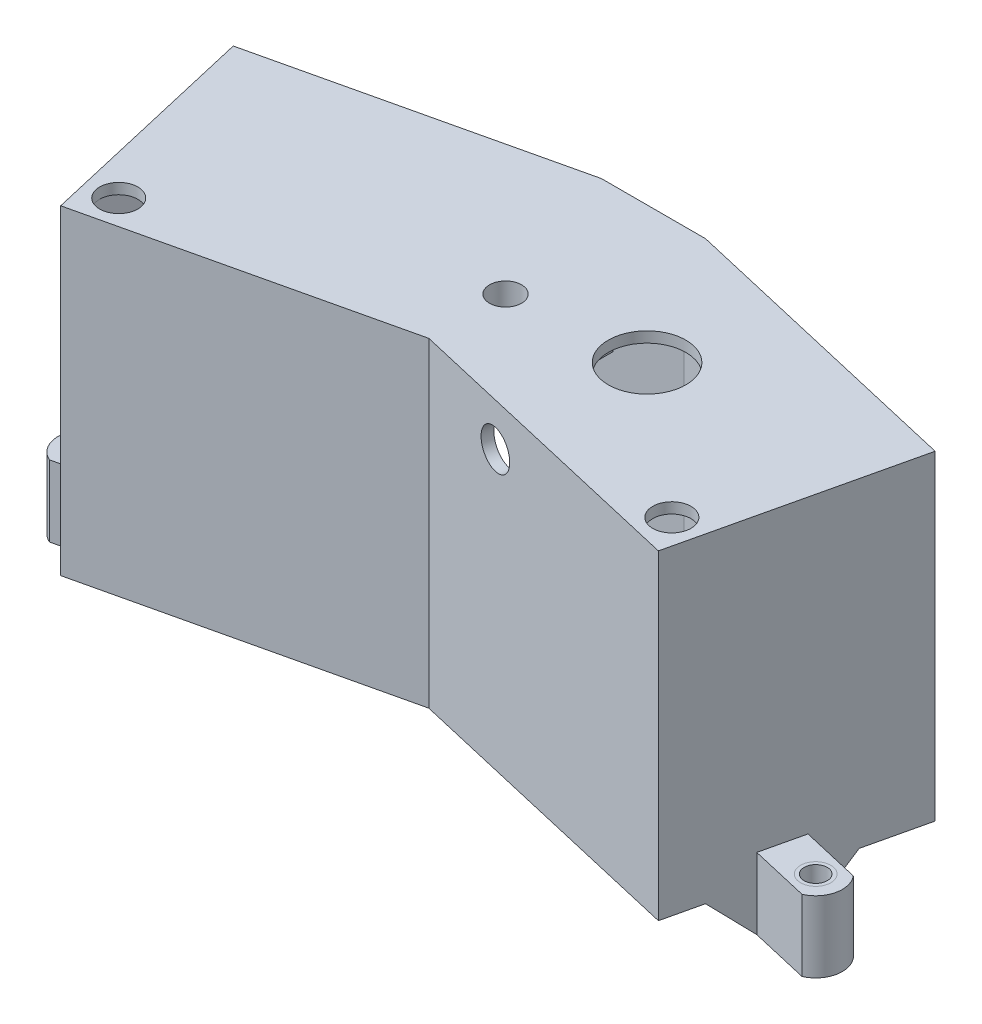
from build123d import *

# Parameters (mm, degrees)
EXTERNAL_DIMENSIONS_DEPTH             = 45
INTERNAL_CAVITY_DEPTH                 = 42
SKETCH5_W                             = 80.200000486
SKETCH5_H                             = 84.000000972
FIRST_CUTOUT_DEPTH                    = 2
SKETCH6_R                             = 1.5
SKETCH6_W                             = 70.200000486
SKETCH6_H                             = 74.000000972
SECOND_CUTOUT_HOLES_FOR_INSERTS_DEPTH = 3.1
SKETCH8_W                             = 29.263844186
SKETCH8_H                             = 31.126435476
TOPATTACHMENTSUPPORT_DEPTH            = 15
TOPATTACHMENT_SIZE                    = 2
TOP_HOLE_DEPTH                        = 20
BOTTOMSUPPORT_DEPTH                   = 12
CHAMFER1_SIZE                         = 12
LEFTCUT_DEPTH                         = 60
EXTRACUT_DEPTH                        = 100
SKETCH18_W                            = 12
SKETCH18_H                            = 20
BOTTOMATTACHMENT_DEPTH                = 20
BOTTOM_ATTACHMENT_ROUNDING_REACH      = 154.026
SKETCH19_R                            = 3.25
SKETCH20_R                            = 5.375
WIREEXIT_DEPTH                        = 10
SKETCH23_R                            = 5.375
CHARGERPORT_DEPTH                     = 10
SKETCH29_R                            = 10.9
CUT_EXTRUDE1_DEPTH                    = 10


with BuildPart() as part:
    # Sketch1 → External Dimensions (new, symmetric)
    with BuildSketch(Plane(origin=(0, 0, 0), x_dir=(1, 0, 0), z_dir=(0, 1, 0))):
        Polygon((0, 0), (83.973745957, -19.464069204), (98.60566805, 43.662366272), (14.631922093, 63.126435476), (-14.631922093, 63.126435476), (-98.60566805, 43.662366272), (-83.973745957, -19.464069204), align=None)
    extrude(amount=EXTERNAL_DIMENSIONS_DEPTH, both=True)

    # Sketch4 → Internal Cavity (cut, symmetric)
    with BuildSketch(Plane(origin=(0, 0, 0), x_dir=(1, 0, 0), z_dir=(0, 1, 0))):
        Polygon((-0.677403801, 2.922520161), (0.677403801, 2.922520161), (81.728629596, -15.864145243), (94.554142028, 39.468903028), (13.502915759, 58.255568541), (-13.502915759, 58.255568541), (-94.554142028, 39.468903028), (-81.728629596, -15.864145243), align=None)
    extrude(amount=INTERNAL_CAVITY_DEPTH, both=True, mode=Mode.SUBTRACT)

    # Sketch5 → First Cutout (cut)
    with BuildSketch(Plane(origin=(14.631922093, 0, -63.126435476), x_dir=(-0.9741733869698493, 0, -0.22580126686910412), z_dir=(0.22580126686910412, 0, -0.9741733869698493))):
        with Locations((-43.100000243, 0)):
            Rectangle(SKETCH5_W, SKETCH5_H)
    first_cutout = extrude(amount=-FIRST_CUTOUT_DEPTH, mode=Mode.SUBTRACT)

    # Sketch6 → Second Cutout + Holes for Inserts (cut)
    with BuildSketch(Plane(origin=(14.180319559, 0, -61.178088702), x_dir=(-0.9741733869698493, 0, -0.2258012668691041), z_dir=(0.2258012668691041, 0, -0.9741733869698493))):
        with Locations((-80.700000486, 39.500000486)):
            Circle(SKETCH6_R)
        with Locations((-5.499999514, 39.500000486)):
            Circle(SKETCH6_R)
        with Locations((-5.499999514, -39.500000486)):
            Circle(SKETCH6_R)
        with Locations((-80.700000486, -39.500000486)):
            Circle(SKETCH6_R)
        with Locations((-43.100000243, 0)):
            Rectangle(SKETCH6_W, SKETCH6_H)
    second_cutout_holes_for_inserts = extrude(amount=-SECOND_CUTOUT_HOLES_FOR_INSERTS_DEPTH, mode=Mode.SUBTRACT)

    # Mirror1: First Cutout, Second Cutout + Holes for Inserts across plane
    add(first_cutout.mirror(Plane(origin=(0, 0, 0), x_dir=(0, 0, 1), z_dir=(1, 0, 0))), mode=Mode.SUBTRACT)
    add(second_cutout_holes_for_inserts.mirror(Plane(origin=(0, 0, 0), x_dir=(0, 0, 1), z_dir=(1, 0, 0))), mode=Mode.SUBTRACT)

    # Sketch8 → TopAttachmentSupport (add)
    with BuildSketch(Plane(origin=(0, 43.5, 0), x_dir=(1, 0, 0), z_dir=(0, 1, 0))):
        with Locations((0, 21.563217738)):
            Rectangle(SKETCH8_W, SKETCH8_H)
    extrude(amount=-TOPATTACHMENTSUPPORT_DEPTH)

    # TopAttachment
    topattachment_edges = [part.edges().sort_by_distance(p)[0] for p in [
        (0, 28.5, -6),
        (0, 28.5, -37.126435476),
        (14.631922093, 28.5, -21.563217738),
        (-14.631922093, 28.5, -21.563217738),
    ]]
    chamfer(topattachment_edges, length=TOPATTACHMENT_SIZE)

    # Sketch9 → Top Hole (cut)
    with BuildSketch(Plane(origin=(0, 28.5, 0), x_dir=(-1, 0, 0), z_dir=(0, -1, 0))):
        with BuildLine():
            ThreePointArc((4.5, 21.563217738), (3.181980515, 24.745198253), (0, 26.063217738))
            Line((0, 26.063217738), (0, 17.063217738))
            ThreePointArc((0, 17.063217738), (3.181980515, 18.381237222), (4.5, 21.563217738))
        make_face()
        with BuildLine():
            Line((0, 17.063217738), (0, 26.063217738))
            ThreePointArc((0, 26.063217738), (-4.5, 21.563217738), (0, 17.063217738))
        make_face()
    extrude(amount=-TOP_HOLE_DEPTH, mode=Mode.SUBTRACT)

    # Sketch10 → BottomSupport (add)
    with BuildSketch(Plane.XZ.offset(45)):
        Polygon((-89.175695767, -2.978679395), (0, -23.648495823), (89.175695767, -2.978679395), (91.88531097, -14.668760038), (0, -35.966631548), (-91.88531097, -14.668760038), align=None)
    extrude(amount=BOTTOMSUPPORT_DEPTH)

    # Chamfer1
    chamfer1_edges = [part.edges().sort_by_distance(p)[0] for p in [
        (45.942655485, -45, -25.317695793),
        (44.587847884, -45, -13.313587609),
        (-44.587847884, -45, -13.313587609),
        (-45.942655485, -45, -25.317695793),
    ]]
    chamfer(chamfer1_edges, length=CHAMFER1_SIZE - 0.0001)  # a hair under: the kernel refuses the full size

    # Sketch14 → LeftCut (cut)
    with BuildSketch(Plane(origin=(0, 0, 0), x_dir=(0.9741733869698491, 0, -0.22580126686910457), z_dir=(0.22580126686910457, 0, 0.9741733869698491))):
        Polygon((2.558409664, -45), (-86.2, -57), (5.339860316, -57), align=None)
    leftcut = extrude(amount=-LEFTCUT_DEPTH, mode=Mode.SUBTRACT)

    # Mirror2: LeftCut across plane
    add(leftcut.mirror(Plane(origin=(0, 0, 0), x_dir=(0, 0, 1), z_dir=(1, 0, 0))), mode=Mode.SUBTRACT)

    # Sketch17 → ExtraCut (cut)
    with BuildSketch(Plane.XZ.offset(45)):
        Polygon((0, -11.330360098), (8.128845607, -46.400602029), (0, -48.284767272), (-8.128845607, -46.400602029), align=None)
    extrude(amount=EXTRACUT_DEPTH, mode=Mode.SUBTRACT)

    # Sketch18 → BottomAttachment (add)
    with BuildSketch(Plane(origin=(83.973745957, 0, 19.464069204), x_dir=(0.22580126686910407, 0, -0.9741733869698493), z_dir=(0.9741733869698493, 0, 0.22580126686910407))):
        with Locations((29.037735273, -47)):
            Rectangle(SKETCH18_W, SKETCH18_H)
    bottomattachment = extrude(amount=BOTTOMATTACHMENT_DEPTH)

    # Sketch19 → Bottom Attachment Rounding (cut, up to next)
    with BuildSketch(Plane(origin=(0, -37, 0), x_dir=(1, 0, 0), z_dir=(0, 1, 0)), mode=Mode.PRIVATE) as bottom_attachment_rounding_sk1:
        with Locations(Location((102.707670706, 6.001203881, 0), (0, 0, 270))):
            Circle(SKETCH19_R)
    bottom_attachment_rounding_tool1 = extrude(bottom_attachment_rounding_sk1.sketch, amount=-BOTTOM_ATTACHMENT_ROUNDING_REACH, mode=Mode.PRIVATE) & part.part
    # Sketch19 → Bottom Attachment Rounding (cut, up to next)
    with BuildSketch(Plane(origin=(0, -37, 0), x_dir=(1, 0, 0), z_dir=(0, 1, 0)), mode=Mode.PRIVATE) as bottom_attachment_rounding_sk2:
        with BuildLine():
            ThreePointArc((110.013971108, 4.307694379), (109.999984924, 7.753959807), (108.446258548, 10.830138501))
            Line((108.446258548, 10.830138501), (111.368778709, 10.152734701))
            Line((111.368778709, 10.152734701), (110.013971108, 4.307694379))
        make_face()
    bottom_attachment_rounding_tool2 = extrude(bottom_attachment_rounding_sk2.sketch, amount=-BOTTOM_ATTACHMENT_ROUNDING_REACH, mode=Mode.PRIVATE) & part.part
    # Sketch19 → Bottom Attachment Rounding (cut, up to next)
    with BuildSketch(Plane(origin=(0, -37, 0), x_dir=(1, 0, 0), z_dir=(0, 1, 0)), mode=Mode.PRIVATE) as bottom_attachment_rounding_sk3:
        with BuildLine():
            Line((110.013971108, 4.307694379), (108.659163507, -1.537345943))
            Line((108.659163507, -1.537345943), (105.736643346, -0.859942142))
            ThreePointArc((105.736643346, -0.859942142), (108.485263978, 1.219006062), (110.013971108, 4.307694379))
        make_face()
    bottom_attachment_rounding_tool3 = extrude(bottom_attachment_rounding_sk3.sketch, amount=-BOTTOM_ATTACHMENT_ROUNDING_REACH, mode=Mode.PRIVATE) & part.part
    bottom_attachment_rounding_1 = bottom_attachment_rounding_tool1.solids().sort_by_distance((102.707671, -37, -6.001204))[0]
    add(bottom_attachment_rounding_1, mode=Mode.SUBTRACT)
    bottom_attachment_rounding_2 = bottom_attachment_rounding_tool2.solids().sort_by_distance((110.209545, -37, -8.949999))[0]
    add(bottom_attachment_rounding_2, mode=Mode.SUBTRACT)
    bottom_attachment_rounding_3 = bottom_attachment_rounding_tool3.solids().sort_by_distance((108.14727, -37, -0.052736))[0]
    add(bottom_attachment_rounding_3, mode=Mode.SUBTRACT)
    bottom_attachment_rounding = bottom_attachment_rounding_1 + bottom_attachment_rounding_2 + bottom_attachment_rounding_3  # Bottom Attachment Rounding as one shape, for the pattern or mirror that repeats it

    # Mirror3: BottomAttachment, Bottom Attachment Rounding across plane
    add(bottomattachment.mirror(Plane(origin=(0, 0, 0), x_dir=(0, 0, 1), z_dir=(1, 0, 0))))
    add(bottom_attachment_rounding.mirror(Plane(origin=(0, 0, 0), x_dir=(0, 0, 1), z_dir=(1, 0, 0))), mode=Mode.SUBTRACT)

    # Sketch20 → WireExit (cut)
    with BuildSketch(Plane(origin=(40.135943543, 45, 9.303012195), x_dir=(0.22580126686910407, 0, -0.9741733869698493), z_dir=(0, -1, 0))):
        with Locations(Location((8.375, 36.625, 0), (0, 0, 180))):
            Circle(SKETCH20_R)
    wireexit = extrude(amount=WIREEXIT_DEPTH, mode=Mode.SUBTRACT)

    # Mirror4: WireExit across plane
    add(wireexit.mirror(Plane(origin=(0, 0, 0), x_dir=(0, 0, 1), z_dir=(1, 0, 0))), mode=Mode.SUBTRACT)

    # Sketch23 → ChargerPort (cut)
    with BuildSketch(Plane(origin=(0, 0, 0), x_dir=(0.9741733869698492, 0, 0.22580126686910437), z_dir=(-0.22580126686910437, 0, 0.9741733869698492))):
        with Locations((25, 33)):
            Circle(SKETCH23_R)
    extrude(amount=-CHARGERPORT_DEPTH, mode=Mode.SUBTRACT)

    # Sketch29 → Cut-Extrude1 (cut)
    with BuildSketch(Plane(origin=(0, 45, 0), x_dir=(1, 0, 0), z_dir=(0, 1, 0))):
        with Locations(Location((36.541162656, 24.789179732, 0), (0, 0, 270))):
            Circle(SKETCH29_R)
    extrude(amount=-CUT_EXTRUDE1_DEPTH, mode=Mode.SUBTRACT)


solid = part.part
